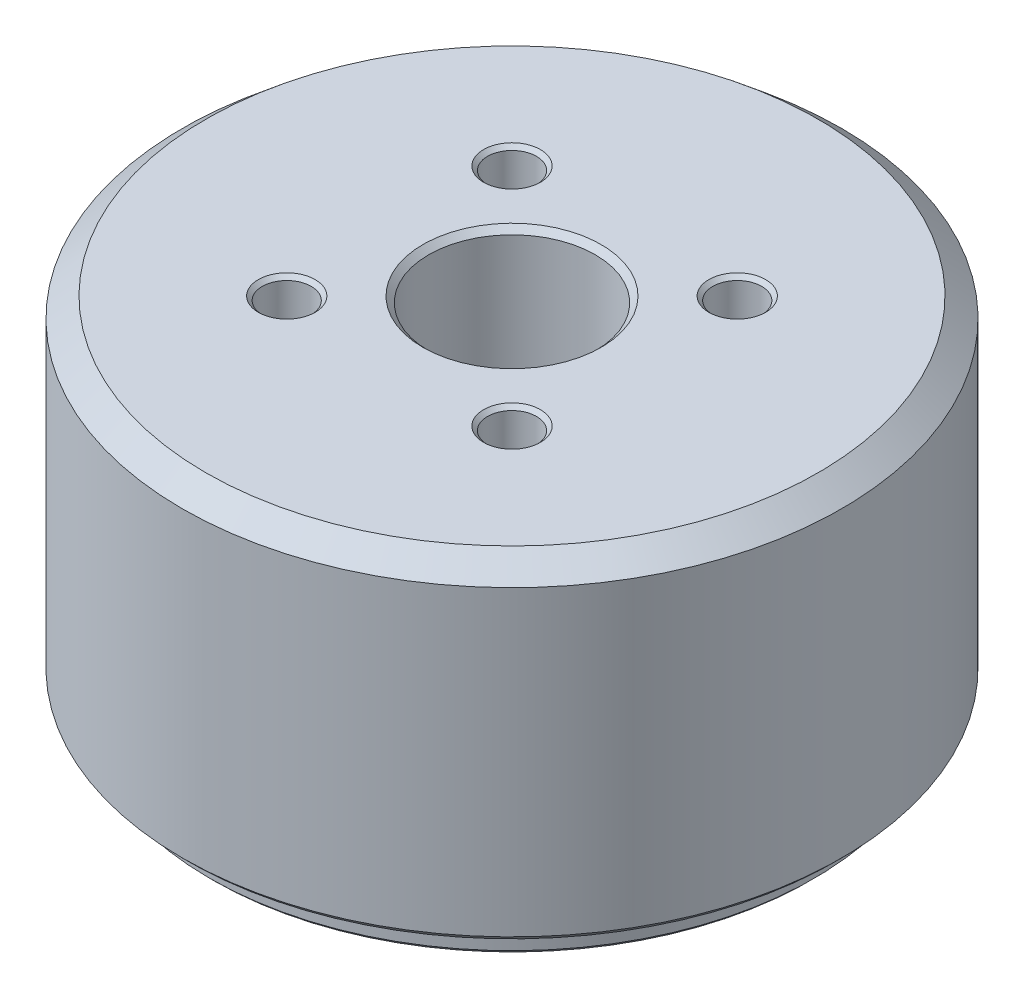
from build123d import *

# Parameters (mm, degrees)
SKETCH_1_R          = 16.825
SKETCH_1_R_2        = 4.25
EXTRUDE_1_DEPTH     = 18.24
EXTRUDE_START       = 1.76
SKETCH_2_R          = 6.025
SKETCH_2_R_2        = 4.25
EXTRUDE_2_DEPTH     = 1.76
SKETCH_3_R          = 1.25
CUT_EXTRUDE_1_DEPTH = 4.5
SKETCH_4_R          = 1.25
CUT_EXTRUDE_2_DEPTH = 2.5
SKETCH_5_R          = 16.825
SKETCH_5_R_2        = 15.425
CUT_EXTRUDE_3_DEPTH = 1.5
SKETCH_6_R          = 6.025
SKETCH_6_R_2        = 5.79
CUT_EXTRUDE_4_DEPTH = 1.26
CUT_EXTRUDE_5_DEPTH = 0.5
CHAMFER_1_SIZE      = 1
CHAMFER_1_SIZE2     = 1.191753593
CHAMFER_2_SIZE      = 0.3
CHAMFER_3_SIZE      = 0.2
CHAMFER_4_SIZE      = 0.2
CHAMFER_5_SIZE      = 0.2
CHAMFER_6_SIZE      = 0.3
FILLET_1_R          = 0.3
FILLET_2_R          = 0.4


with BuildPart() as part:
    # 草图1 → 凸台-拉伸1 (new body)
    with BuildSketch(Plane(origin=(0, 0, 0), x_dir=(1, 0, 0), z_dir=(0, 1, 0))):
        Circle(SKETCH_1_R)
        Circle(SKETCH_1_R_2, mode=Mode.SUBTRACT)
    extrude(amount=EXTRUDE_1_DEPTH)

    # 草图2 → 凸台-拉伸2 (add)
    with BuildSketch(Plane.XZ.offset(EXTRUDE_START)):
        Circle(SKETCH_2_R)
        Circle(SKETCH_2_R_2, mode=Mode.SUBTRACT)
    extrude(amount=-EXTRUDE_2_DEPTH)

    # 草图3 → 切除-拉伸1 (cut)
    with BuildSketch(Plane.XZ):
        with Locations((-7.75, 7.75)):
            Circle(SKETCH_3_R)
        with Locations((-7.75, -7.75)):
            Circle(SKETCH_3_R)
        with Locations((7.75, 7.75)):
            Circle(SKETCH_3_R)
        with Locations((7.75, -7.75)):
            Circle(SKETCH_3_R)
    extrude(amount=-CUT_EXTRUDE_1_DEPTH, mode=Mode.SUBTRACT)

    # 草图4 → 切除-拉伸2 (cut)
    with BuildSketch(Plane(origin=(0, 18.24, 0), x_dir=(1, 0, 0), z_dir=(0, 1, 0))):
        with Locations((-5.75, 5.75)):
            Circle(SKETCH_4_R)
        with Locations((-5.75, -5.75)):
            Circle(SKETCH_4_R)
        with Locations((5.75, -5.75)):
            Circle(SKETCH_4_R)
        with Locations((5.75, 5.75)):
            Circle(SKETCH_4_R)
    extrude(amount=-CUT_EXTRUDE_2_DEPTH, mode=Mode.SUBTRACT)

    # 草图5 → 切除-拉伸3 (cut)
    with BuildSketch(Plane.XZ):
        Circle(SKETCH_5_R)
        Circle(SKETCH_5_R_2, mode=Mode.SUBTRACT)
    extrude(amount=-CUT_EXTRUDE_3_DEPTH, mode=Mode.SUBTRACT)

    # 草图6 → 切除-拉伸4 (cut)
    with BuildSketch(Plane.XZ.offset(1.76)):
        Circle(SKETCH_6_R)
        Circle(SKETCH_6_R_2, mode=Mode.SUBTRACT)
    extrude(amount=-CUT_EXTRUDE_4_DEPTH, mode=Mode.SUBTRACT)

    # 草图7 → 切除-拉伸5 (cut)
    with BuildSketch(Plane.XZ):
        with BuildLine():
            Line((-1.025, 12.525), (1.025, 12.525))
            ThreePointArc((1.025, 12.525), (2.025, 11.525), (1.025, 10.525))
            Line((1.025, 10.525), (-1.025, 10.525))
            ThreePointArc((-1.025, 10.525), (-2.025, 11.525), (-1.025, 12.525))
        make_face()
    extrude(amount=-CUT_EXTRUDE_5_DEPTH, mode=Mode.SUBTRACT)

    # 倒角1
    chamfer_1_edges = [part.edges().sort_by_distance(p)[0] for p in [
        (-16.825, 18.24, 0),
    ]]
    chamfer_1_side = [part.faces().sort_by_distance(p)[0] for p in [
        (-16.825, 9.87, 0),
    ]]
    chamfer(chamfer_1_edges, length=CHAMFER_1_SIZE, length2=CHAMFER_1_SIZE2, reference=chamfer_1_side[0])

    # 倒角2
    chamfer_2_edges = [part.edges().sort_by_distance(p)[0] for p in [
        (-16.825, 1.5, 0),
    ]]
    chamfer(chamfer_2_edges, length=CHAMFER_2_SIZE)

    # 倒角3
    chamfer_3_edges = [part.edges().sort_by_distance(p)[0] for p in [
        (-15.425, 0, 0),
    ]]
    chamfer(chamfer_3_edges, length=CHAMFER_3_SIZE)

    # 倒角4
    chamfer_4_edges = [part.edges().sort_by_distance(p)[0] for p in [
        (-9, 0, -7.75),
        (6.5, 0, -7.75),
        (6.5, 0, 7.75),
        (-9, 0, 7.75),
    ]]
    chamfer(chamfer_4_edges, length=CHAMFER_4_SIZE)

    # 倒角5
    chamfer_5_edges = [part.edges().sort_by_distance(p)[0] for p in [
        (-7, 18.24, -5.75),
        (4.5, 18.24, -5.75),
        (4.5, 18.24, 5.75),
        (-7, 18.24, 5.75),
    ]]
    chamfer(chamfer_5_edges, length=CHAMFER_5_SIZE)

    # 倒角6
    chamfer_6_edges = [part.edges().sort_by_distance(p)[0] for p in [
        (-4.25, 18.24, 0),
    ]]
    chamfer(chamfer_6_edges, length=CHAMFER_6_SIZE)

    # 圆角1
    fillet_1_edges = [part.edges().sort_by_distance(p)[0] for p in [
        (-4.25, -1.76, 0),
    ]]
    fillet(fillet_1_edges, radius=FILLET_1_R)

    # 圆角2
    fillet_2_edges = [part.edges().sort_by_distance(p)[0] for p in [
        (-5.79, -1.76, 0),
    ]]
    fillet(fillet_2_edges, radius=FILLET_2_R)


solid = part.part
